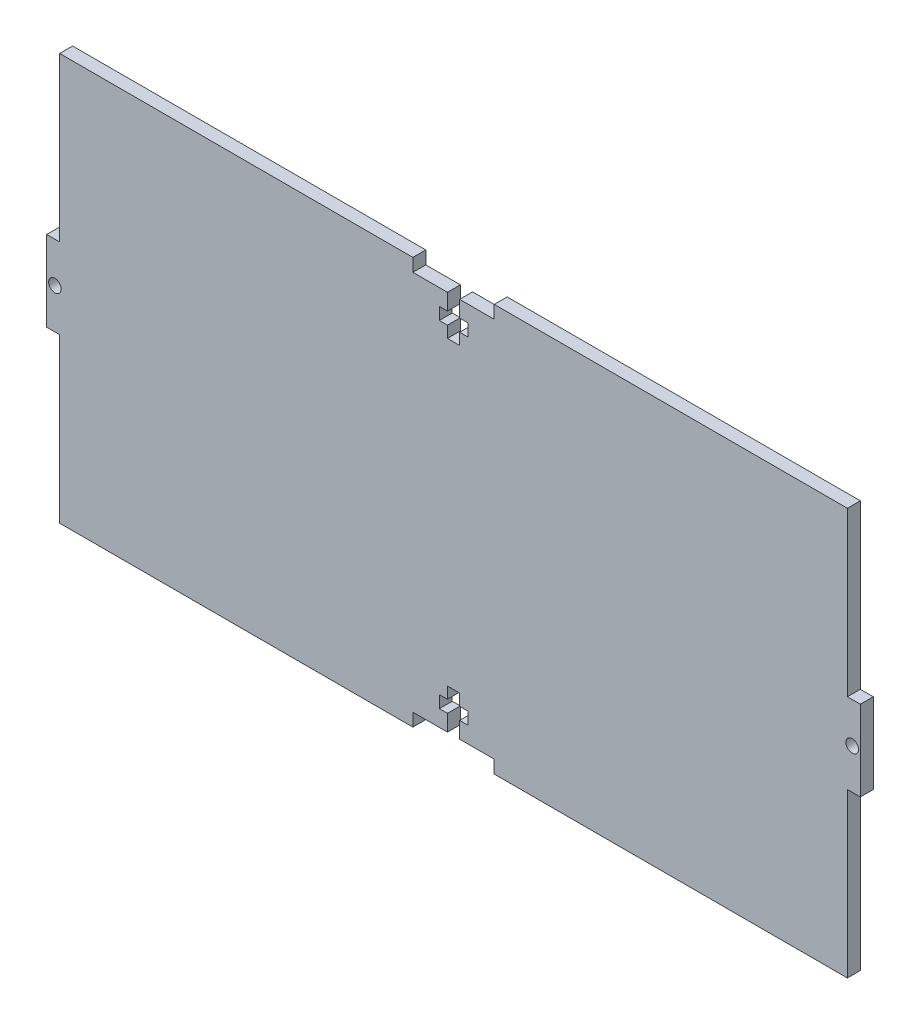
from build123d import *

# Parameters (mm, degrees)
SKETCH1_W           = 200
SKETCH1_H           = 100
BOSS_EXTRUDE2_DEPTH = 3.18
SKETCH2_R           = 1.55
SKETCH2_W           = 3.18
SKETCH2_H           = 40.125
CUT_EXTRUDE1_DEPTH  = 112.84861376


with BuildPart() as part:
    # Sketch1 → Boss-Extrude2 (new body)
    with BuildSketch(Plane.XY):
        Rectangle(SKETCH1_W, SKETCH1_H)
    extrude(amount=BOSS_EXTRUDE2_DEPTH)

    # Sketch2 → Cut-Extrude1 (cut, through all)
    with BuildSketch(Plane.XY.offset(3.18)):
        with Locations((-98, 0)):
            Circle(SKETCH2_R)
        Polygon((-10, 50), (-10, 46.82), (-1.5, 46.82), (-1.5, 42.82), (-3.5, 42.82), (-3.5, 39.82), (-1.5, 39.82), (-1.5, 37), (1.5, 37), (1.5, 39.82), (3.5, 39.82), (3.5, 42.82), (1.5, 42.82), (1.5, 46.82), (10, 46.82), (10, 50), align=None)
        with Locations((-98.41, 29.9375)):
            Rectangle(SKETCH2_W, SKETCH2_H)
        with Locations((-98.41, -29.9375)):
            Rectangle(SKETCH2_W, SKETCH2_H)
    cut_extrude1 = extrude(amount=-CUT_EXTRUDE1_DEPTH, mode=Mode.SUBTRACT)

    # Mirror1: Cut-Extrude1 across plane
    add(cut_extrude1.mirror(Plane.ZX), mode=Mode.SUBTRACT)

    # Mirror2: Cut-Extrude1 across plane
    add(cut_extrude1.mirror(Plane(origin=(0, 0, 0), x_dir=(0, 0, 1), z_dir=(1, 0, 0))), mode=Mode.SUBTRACT)


solid = part.part
